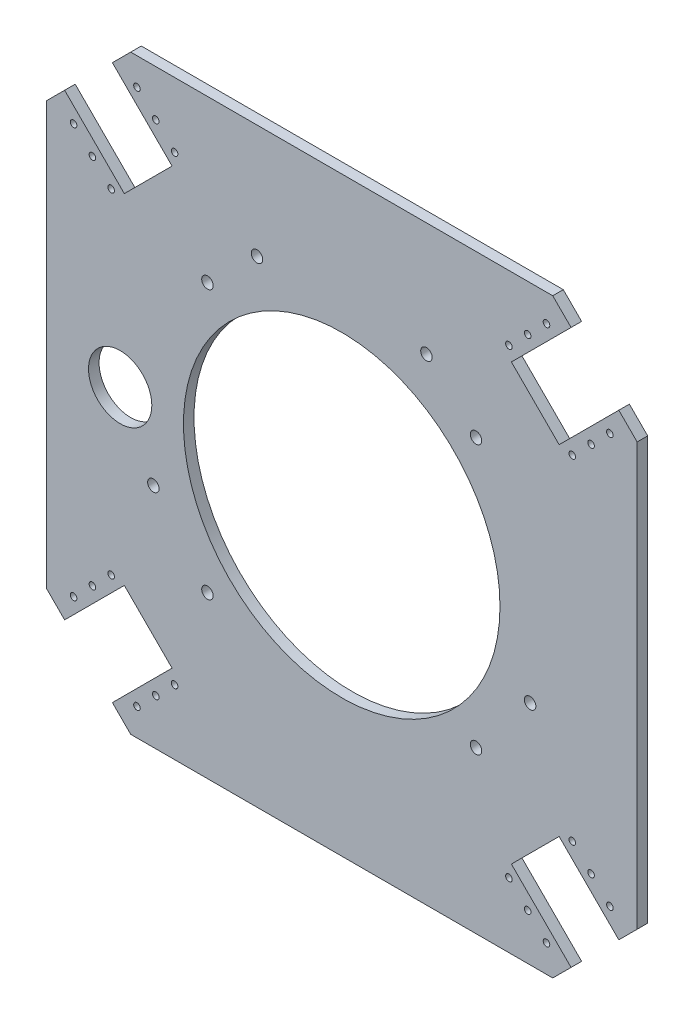
from build123d import *

# Parameters (mm, degrees)
SKETCH1_R          = 9.525
SKETCH1_R_2        = 0.9906
SKETCH1_R_3        = 47.625
EXTRUDE1_DEPTH     = 3.175
SKETCH2_R          = 1.7272
CUT_EXTRUDE1_DEPTH = 3.175
SPLIT1_START       = -3.175
SPLIT1_OUTLINE_R   = 1.7272
SPLIT1_DEPTH       = 3.175


# Read off the part's stored shape, not the designer's step: Split1
with BuildPart() as part:
    # Sketch1 → Extrude1 (new body)
    with BuildSketch(Plane.XY):
        Polygon((-88.9, 63.5), (-83.384204897, 69.015795103), (-65.423692655, 51.055282861), (-51.055282861, 65.423692655), (-69.015795103, 83.384204897), (-63.5, 88.9), (63.5, 88.9), (69.015795103, 83.384204897), (51.055282861, 65.423692655), (65.423692655, 51.055282861), (83.384204897, 69.015795103), (88.9, 63.5), (88.9, -63.5), (83.384204897, -69.015795103), (65.423692655, -51.055282861), (51.055282861, -65.423692655), (69.015795103, -83.384204897), (63.5, -88.9), (-63.5, -88.9), (-69.015795103, -83.384204897), (-51.055282861, -65.423692655), (-65.423692655, -51.055282861), (-83.384204897, -69.015795103), (-88.9, -63.5), align=None)
        with Locations((-66.675, 0)):
            Circle(SKETCH1_R, mode=Mode.SUBTRACT)
        with Locations((-80.690128061, 61.616064059)):
            Circle(SKETCH1_R_2, mode=Mode.SUBTRACT)
        with Locations((-75.032566704, 55.958502703)):
            Circle(SKETCH1_R_2, mode=Mode.SUBTRACT)
        with Locations((-69.375005348, 50.300941347)):
            Circle(SKETCH1_R_2, mode=Mode.SUBTRACT)
        with Locations(Location((-50.300941347, 69.375005348, 0), (0, 0, 180))):
            Circle(SKETCH1_R_2, mode=Mode.SUBTRACT)
        with Locations(Location((-55.958502703, 75.032566704, 0), (0, 0, 180))):
            Circle(SKETCH1_R_2, mode=Mode.SUBTRACT)
        with Locations(Location((-61.616064059, 80.690128061, 0), (0, 0, 180))):
            Circle(SKETCH1_R_2, mode=Mode.SUBTRACT)
        with Locations((50.300941347, 69.375005348)):
            Circle(SKETCH1_R_2, mode=Mode.SUBTRACT)
        with Locations((55.958502703, 75.032566704)):
            Circle(SKETCH1_R_2, mode=Mode.SUBTRACT)
        with Locations((61.616064059, 80.690128061)):
            Circle(SKETCH1_R_2, mode=Mode.SUBTRACT)
        with Locations(Location((69.375005348, 50.300941347, 0), (0, 0, 180))):
            Circle(SKETCH1_R_2, mode=Mode.SUBTRACT)
        with Locations(Location((75.032566704, 55.958502703, 0), (0, 0, 180))):
            Circle(SKETCH1_R_2, mode=Mode.SUBTRACT)
        with Locations(Location((80.690128061, 61.616064059, 0), (0, 0, 180))):
            Circle(SKETCH1_R_2, mode=Mode.SUBTRACT)
        with Locations((80.690128061, -61.616064059)):
            Circle(SKETCH1_R_2, mode=Mode.SUBTRACT)
        with Locations((75.032566704, -55.958502703)):
            Circle(SKETCH1_R_2, mode=Mode.SUBTRACT)
        with Locations((69.375005348, -50.300941347)):
            Circle(SKETCH1_R_2, mode=Mode.SUBTRACT)
        with Locations(Location((61.616064059, -80.690128061, 0), (0, 0, 180))):
            Circle(SKETCH1_R_2, mode=Mode.SUBTRACT)
        with Locations(Location((55.958502703, -75.032566704, 0), (0, 0, 180))):
            Circle(SKETCH1_R_2, mode=Mode.SUBTRACT)
        with Locations(Location((50.300941347, -69.375005348, 0), (0, 0, 180))):
            Circle(SKETCH1_R_2, mode=Mode.SUBTRACT)
        with Locations((-61.616064059, -80.690128061)):
            Circle(SKETCH1_R_2, mode=Mode.SUBTRACT)
        with Locations((-55.958502703, -75.032566704)):
            Circle(SKETCH1_R_2, mode=Mode.SUBTRACT)
        with Locations((-50.300941347, -69.375005348)):
            Circle(SKETCH1_R_2, mode=Mode.SUBTRACT)
        with Locations(Location((-80.690128061, -61.616064059, 0), (0, 0, 180))):
            Circle(SKETCH1_R_2, mode=Mode.SUBTRACT)
        with Locations(Location((-75.032566704, -55.958502703, 0), (0, 0, 180))):
            Circle(SKETCH1_R_2, mode=Mode.SUBTRACT)
        with Locations(Location((-69.375005348, -50.300941347, 0), (0, 0, 180))):
            Circle(SKETCH1_R_2, mode=Mode.SUBTRACT)
        Circle(SKETCH1_R_3, mode=Mode.SUBTRACT)
    extrude(amount=-EXTRUDE1_DEPTH)

    # Sketch2 → Cut-Extrude1 (cut)
    with BuildSketch(Plane(origin=(0, 0, -3.175), x_dir=(-1, 0, 0), z_dir=(0, 0, -1))):
        with Locations((-40.411152545, -40.411152545)):
            Circle(SKETCH2_R)
        with Locations((40.411152545, 40.411152545)):
            Circle(SKETCH2_R)
        with Locations((40.411152545, -40.411152545)):
            Circle(SKETCH2_R)
        with Locations((-40.411152545, 40.411152545)):
            Circle(SKETCH2_R)
    extrude(amount=-CUT_EXTRUDE1_DEPTH, mode=Mode.SUBTRACT)

    # Split1 outline → Split1 (cut)
    with BuildSketch(Plane.XY.offset(SPLIT1_START)):
        with Locations((25.49444664, 54.673017253)):
            Circle(SPLIT1_OUTLINE_R)
        with Locations((-56.686957349, -20.632365146)):
            Circle(SPLIT1_OUTLINE_R)
        with Locations((-25.49444664, 54.673017253)):
            Circle(SPLIT1_OUTLINE_R)
        with Locations((56.686957349, -20.632365146)):
            Circle(SPLIT1_OUTLINE_R)
    extrude(amount=SPLIT1_DEPTH, mode=Mode.SUBTRACT)


solid = part.part
